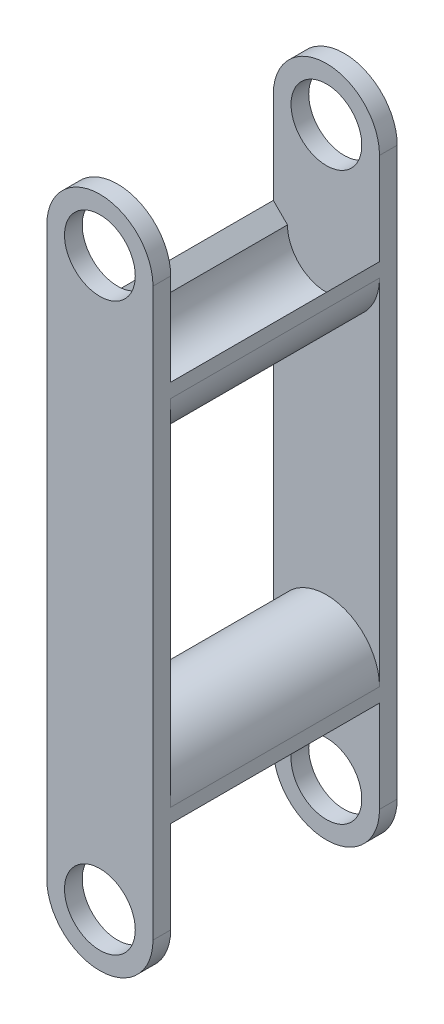
from build123d import *
from build123d.topology import SkipClean

# Parameters (mm, degrees)
SKETCH2_R           = 10
BOSS_EXTRUDE2_DEPTH = 5
BOSS_EXTRUDE3_START = 59
BOSS_EXTRUDE3_DEPTH = 59
BOSS_EXTRUDE4_START = 5
SKETCH4_R           = 10
BOSS_EXTRUDE4_DEPTH = 5
BOSS_EXTRUDE5_START = -5
BOSS_EXTRUDE5_DEPTH = 5
CUT_EXTRUDE1_START  = -5
SKETCH6_R           = 10
CUT_EXTRUDE1_DEPTH  = 5


with BuildPart() as part:
    # Sketch2 → Boss-Extrude2 (new body)
    with BuildSketch(Plane.XY):
        with BuildLine():
            Line((-15, 0), (-15, 30))
            ThreePointArc((-15, 30), (0, 45), (15, 30))
            Line((15, 30), (15, 0))
            ThreePointArc((15, 0), (0, -15), (-15, 0))
        make_face()
        Circle(SKETCH2_R, mode=Mode.SUBTRACT)
    boss_extrude2 = extrude(amount=BOSS_EXTRUDE2_DEPTH)

    # Sketch3 → Boss-Extrude3 (add)
    with BuildSketch(Plane(origin=(0, 0, 0), x_dir=(-1, 0, 0), z_dir=(0, 0, -1)).offset(BOSS_EXTRUDE3_START)):
        with BuildLine():
            Line((-15, 30), (-15, 26))
            Line((-15, 26), (-11, 30))
            ThreePointArc((-11, 30), (0, 41), (11, 30))
            Line((11, 30), (15, 26))
            Line((15, 26), (15, 30))
            ThreePointArc((15, 30), (0, 45), (-15, 30))
        make_face()
    boss_extrude3 = extrude(amount=-BOSS_EXTRUDE3_DEPTH)

    # Sketch4 → Boss-Extrude4 (add)
    with BuildSketch(Plane(origin=(0, 0, -59), x_dir=(-1, 0, 0), z_dir=(0, 0, -1)).offset(BOSS_EXTRUDE4_START)):
        with BuildLine():
            Line((-15, 30), (-15, 0))
            ThreePointArc((-15, 0), (0, -15), (15, 0))
            Line((15, 0), (15, 30))
            ThreePointArc((15, 30), (0, 45), (-15, 30))
        make_face()
        Circle(SKETCH4_R, mode=Mode.SUBTRACT)
    boss_extrude4 = extrude(amount=-BOSS_EXTRUDE4_DEPTH)

    # Sketch5 → Boss-Extrude5 (add)
    with BuildSketch(Plane.XY.offset(5).offset(BOSS_EXTRUDE5_START)):
        with BuildLine():
            Line((-15, 160), (-15, 0))
            Line((-15, 0), (-10, 0))
            ThreePointArc((-10, 0), (0, 10), (10, 0))
            Line((10, 0), (15, 0))
            Line((15, 0), (15, 160))
            Line((15, 160), (-15, 160))
        make_face()
    boss_extrude5 = extrude(amount=BOSS_EXTRUDE5_DEPTH)

    # Mirror1: Boss-Extrude2, Boss-Extrude3, Boss-Extrude4 across plane
    add(boss_extrude2.mirror(Plane.ZX.offset(80)))
    add(boss_extrude3.mirror(Plane.ZX.offset(80)))
    add(boss_extrude4.mirror(Plane.ZX.offset(80)))

    # Sketch6 → Cut-Extrude1 (cut)
    with BuildSketch(Plane.XY.offset(5).offset(CUT_EXTRUDE1_START)):
        with Locations((0, 160)):
            Circle(SKETCH6_R)
    cut_extrude1 = extrude(amount=CUT_EXTRUDE1_DEPTH, mode=Mode.SUBTRACT)

    # Mirror2: Boss-Extrude5, Cut-Extrude1 across plane
    with SkipClean():  # the faces are left unmerged after this step: merging them gives an invalid solid
        add(boss_extrude5.mirror(Plane(origin=(0, 0, -29.5), x_dir=(1, 0, 0), z_dir=(0, 0, -1))))
        add(cut_extrude1.mirror(Plane(origin=(0, 0, -29.5), x_dir=(1, 0, 0), z_dir=(0, 0, -1))), mode=Mode.SUBTRACT)


solid = part.part
